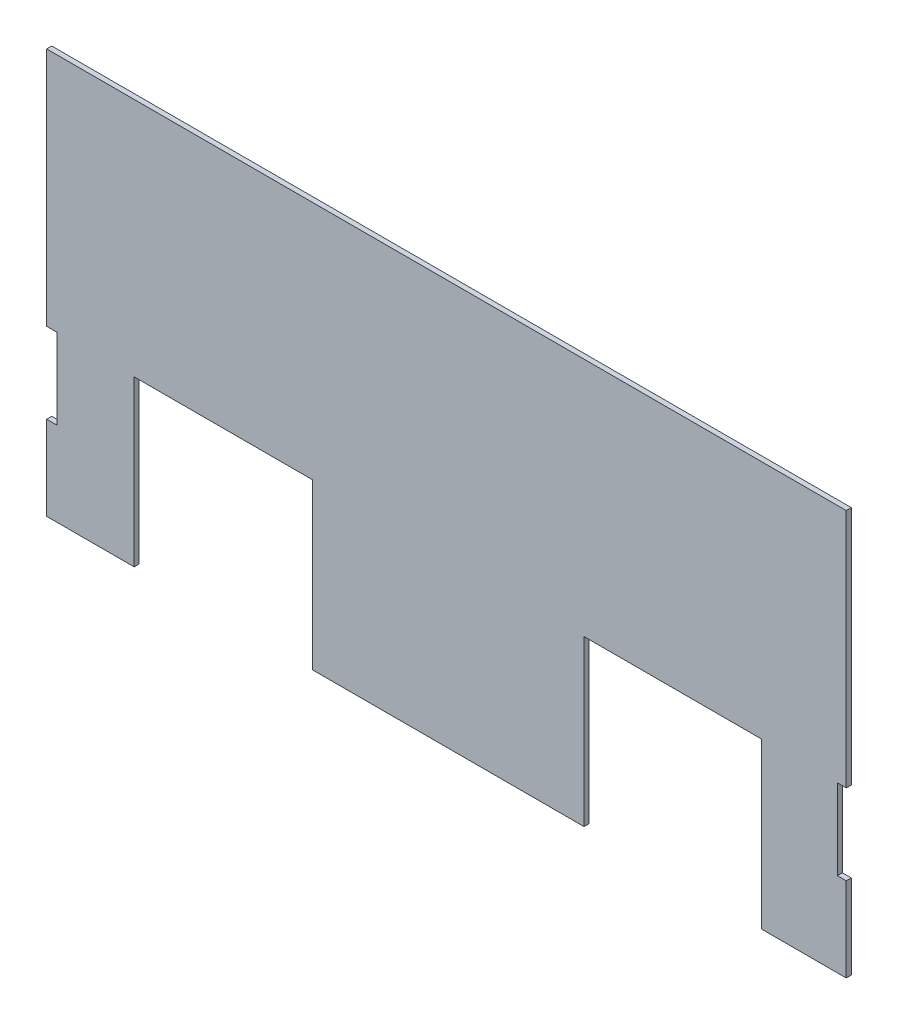
from build123d import *

# Parameters (mm, degrees)
SKETCH1_W           = 752.475
SKETCH1_H           = 381
BOSS_EXTRUDE1_DEPTH = 4.7625
SKETCH2_W           = 8.379539034
SKETCH2_H           = 75.702321135
CUT_EXTRUDE1_DEPTH  = 10.668
SKETCH3_W           = 9.682653374
SKETCH3_H           = 75.707969864
CUT_EXTRUDE2_DEPTH  = 10.668
SKETCH4_W           = 166.904258103
SKETCH4_H           = 154.899111528
CUT_EXTRUDE3_DEPTH  = 10.668
SKETCH5_W           = 167.650404688
SKETCH5_H           = 154.899111528
CUT_EXTRUDE5_DEPTH  = 10.668


with BuildPart() as part:
    # Sketch1 → Boss-Extrude1 (new body)
    with BuildSketch(Plane.XY):
        with Locations((376.2375, -190.5)):
            Rectangle(SKETCH1_W, SKETCH1_H)
    extrude(amount=BOSS_EXTRUDE1_DEPTH)

    # Sketch2 → Cut-Extrude1 (cut)
    with BuildSketch(Plane(origin=(0, 0, 0), x_dir=(-1, 0, 0), z_dir=(0, 0, -1))):
        with Locations((-748.285230483, -263.95204904)):
            Rectangle(SKETCH2_W, SKETCH2_H)
    extrude(amount=-CUT_EXTRUDE1_DEPTH, mode=Mode.SUBTRACT)

    # Sketch3 → Cut-Extrude2 (cut)
    with BuildSketch(Plane(origin=(0, 0, 0), x_dir=(-1, 0, 0), z_dir=(0, 0, -1))):
        with Locations((-4.841326687, -263.949224675)):
            Rectangle(SKETCH3_W, SKETCH3_H)
    extrude(amount=-CUT_EXTRUDE2_DEPTH, mode=Mode.SUBTRACT)

    # Sketch4 → Cut-Extrude3 (cut)
    with BuildSketch(Plane(origin=(0, 0, 0), x_dir=(-1, 0, 0), z_dir=(0, 0, -1))):
        with Locations((-589.168581759, -303.550444236)):
            Rectangle(SKETCH4_W, SKETCH4_H)
    extrude(amount=-CUT_EXTRUDE3_DEPTH, mode=Mode.SUBTRACT)

    # Sketch5 → Cut-Extrude5 (cut)
    with BuildSketch(Plane(origin=(0, 0, 0), x_dir=(-1, 0, 0), z_dir=(0, 0, -1))):
        with Locations((-166.139683848, -303.550444236)):
            Rectangle(SKETCH5_W, SKETCH5_H)
    extrude(amount=-CUT_EXTRUDE5_DEPTH, mode=Mode.SUBTRACT)


solid = part.part
